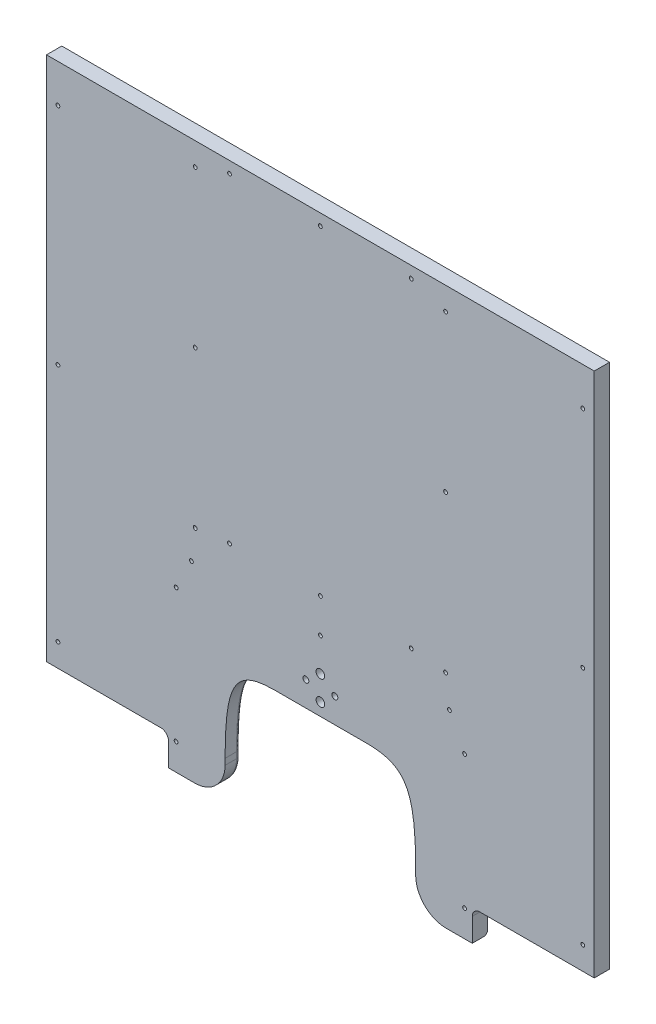
from build123d import *

# Parameters (mm, degrees)
BOSS_EXTRUDE1_DEPTH     = 12.7
FILLET2_SIZE            = 41.275
FILLET2_SIZE_2          = 69.85
FILLET3_R               = 25.4
FILLET4_R               = 19.05
FILLET5_START           = -1
FILLET5_DEPTH           = 15
FILLET6_R               = 127
CUT_EXTRUDE1_REACH      = 634.314
SKETCH3_W               = 241.600142069
SKETCH3_H               = 584.2
F_8_CLEARANCE_HOLE1_D   = 4.9149
F_1_4_CLEARANCE_HOLE1_D = 7.14248
HOLE1_D                 = 3.175
HOLE1_DEPTH             = 38.1
HOLE1_CSINK_D           = 10.16
HOLE1_CSINK_ANGLE       = 82
HOLE1_TIP               = 0.953866233
SKETCH10_W              = 115.111375733
SKETCH10_H              = 146.421249533
CUT_EXTRUDE2_DEPTH      = 25.4
FILLET8_R               = 6.35
FILLET8_OF_MIRROR6_R    = 6.35
FILLET7_R               = 3.175


with BuildPart() as part:
    # Sketch1 → Boss-Extrude1 (new body)
    with BuildSketch(Plane.XY):
        Polygon((-228.088766336, 0), (228.088766336, 0), (228.088766336, -443.878997916), (241.600142069, -584.2), (237.284597128, -584.2), (202.688766336, -463.55), (79.375, -463.55), (79.375, -363.22), (-79.375, -363.22), (-79.375, -463.55), (-202.688766336, -463.55), (-237.284597128, -584.2), (-241.600142069, -584.2), (-228.088766336, -443.878997916), align=None)
    extrude(amount=BOSS_EXTRUDE1_DEPTH)

    # Fillet2
    # a fillet whose section is not a circle: 69.85, 41.275 mm, written as the material it adds along each edge
    with BuildSketch(Plane(origin=(-79.375, -363.22, 0), x_dir=(1, 0, 0), z_dir=(0, 0, 1))) as fillet2_piece_1:
        with BuildLine():
            Bezier((FILLET2_SIZE, 0), (0, 0), (0, -FILLET2_SIZE_2), weights=[1, 1.5, 1])
            Line((0, -FILLET2_SIZE_2), (0, 0))
            Line((0, 0), (FILLET2_SIZE, 0))
        make_face()
    extrude(amount=12.7)

    # Fillet3
    fillet3_edges = [part.edges().sort_by_distance(p)[0] for p in [
        (-79.375, -463.55, 6.35),
    ]]
    fillet(fillet3_edges, radius=FILLET3_R)

    # Fillet4
    fillet4_edges = [part.edges().sort_by_distance(p)[0] for p in [
        (-202.688766336, -463.55, 6.35),
    ]]
    fillet(fillet4_edges, radius=FILLET4_R)

    # Fillet5: read off the stored shape, not the designer's step
    # Fillet5 outline → Fillet5 (cut)
    with BuildSketch(Plane.XY.offset(FILLET5_START)):
        with BuildLine():
            Line((-237.284597128, -584.2), (-224.526592015, -539.707548693))
            add(Edge.make_bspline(
                [(-224.526592015, -539.707548693), (-237.177095318, -583.825096633), (-241.600142069, -584.2)],
                knots=[0, 0, 0, 1, 1, 1], degree=2, weights=[1, 2.333333333, 1]))
            Line((-241.600142069, -584.2), (-237.284597128, -584.2))
        make_face()
    extrude(amount=FILLET5_DEPTH, mode=Mode.SUBTRACT)

    # Fillet6
    # the kernel refuses this fillet: 127 mm, written as the material it adds along each edge
    with BuildSketch(Plane(origin=(-228.088766336, -443.878997916, 0), x_dir=(0, 1, 0), z_dir=(0, 0, 1))) as fillet6_piece_1:
        with BuildLine():
            CenterArc((FILLET6_R * 0.0480334444852, FILLET6_R), FILLET6_R, 264.5, 5.5)
            Line((-FILLET6_R * 0.047812308035, FILLET6_R * 0.00460380163282), (0, 0))
            Line((0, 0), (FILLET6_R * 0.0480334444852, 0))
        make_face()
    extrude(amount=12.7)

    # Sketch3 → Cut-Extrude1 (cut, up to next)
    with BuildSketch(Plane.XY.offset(12.7), mode=Mode.PRIVATE) as cut_extrude1_sk1:
        with Locations((120.800071035, -292.1)):
            Rectangle(SKETCH3_W, SKETCH3_H)
    cut_extrude1_tool1 = extrude(cut_extrude1_sk1.sketch, amount=-CUT_EXTRUDE1_REACH, mode=Mode.PRIVATE) & part.part
    add(cut_extrude1_tool1.solids().sort_by_distance((120.800071, -292.1, 12.7))[0], mode=Mode.SUBTRACT)

    # Mirror5: part across plane


with BuildPart() as part_1:
    add(part.part)
    add(part.part.mirror(Plane(origin=(0, 0, -0.35025), x_dir=(0, 0, 1), z_dir=(-1, 0, 0))))

    # #8 Clearance Hole1 (through all)
    with Locations(Plane(origin=(0, 0, 0), x_dir=(-1, 0, 0), z_dir=(0, 0, -1))):
        with Locations((12.077216058, -342.5825), (-12.077216058, -342.5825)):
            Hole(F_8_CLEARANCE_HOLE1_D / 2)

    # 1/4 Clearance Hole1 (through all)
    with Locations(Plane(origin=(0, 0, 0), x_dir=(-1, 0, 0), z_dir=(0, 0, -1))):
        with Locations((0, -352.7425), (0, -332.4225)):
            Hole(F_1_4_CLEARANCE_HOLE1_D / 2)

    # Hole1
    with Locations(Plane(origin=(0, 0, 0), x_dir=(-1, 0, 0), z_dir=(0, 0, -1))):
        with Locations((-75.688766336, -9.525), (218.563766336, -31.75), (218.563766336, -218.821), (218.563766336, -418.592), (104.263766336, -19.05), (104.263766336, -149.225), (104.263766336, -279.4), (120.138766336, -330.2), (120.138766336, -441.325), (-120.138766336, -441.325), (-120.138766336, -330.2), (-104.263766336, -279.4), (-104.263766336, -149.225), (-104.263766336, -19.05), (-218.563766336, -418.592), (-218.563766336, -218.821), (-218.563766336, -31.75), (0, -304.8), (107.438766336, -304.8), (-107.438766336, -304.8), (75.688766336, -276.225), (0, -276.225), (-75.688766336, -276.225), (75.688766336, -9.525), (0, -9.525)):
            CounterSinkHole(HOLE1_D / 2, HOLE1_CSINK_D / 2, depth=HOLE1_DEPTH, counter_sink_angle=HOLE1_CSINK_ANGLE)
            with Locations((0, 0, -(HOLE1_DEPTH + HOLE1_TIP / 2))):  # 118° drill point
                Cone(0, HOLE1_D / 2, HOLE1_TIP, mode=Mode.SUBTRACT)

    # Sketch10 → Cut-Extrude2 (cut)
    with BuildSketch(Plane(origin=(0, 0, 0), x_dir=(-1, 0, 0), z_dir=(0, 0, -1))):
        with Locations((184.044454203, -510.989375234)):
            Rectangle(SKETCH10_W, SKETCH10_H)
    cut_extrude2 = extrude(amount=-CUT_EXTRUDE2_DEPTH, mode=Mode.SUBTRACT)

    # Fillet8
    fillet8_edges = [part_1.edges().sort_by_distance(p)[0] for p in [
        (-126.488766336, -437.778750467, 6.35),
    ]]
    fillet(fillet8_edges, radius=FILLET8_R)

    # Mirror6: Cut-Extrude2 across plane
    add(cut_extrude2.mirror(Plane(origin=(0, 0, 0), x_dir=(0, 0, 1), z_dir=(1, 0, 0))), mode=Mode.SUBTRACT)

    # Fillet8 of Mirror6
    fillet8_of_mirror6_edges = [part_1.edges().sort_by_distance(p)[0] for p in [
        (126.488766336, -437.778750467, 6.35),
    ]]
    fillet(fillet8_of_mirror6_edges, radius=FILLET8_OF_MIRROR6_R)

    # Fillet7
    fillet7_edges = [part_1.edges().sort_by_distance(p)[0] for p in [
        (115.631883168, -463.55, 0),
        (86.814487758, -456.110512242, 0),
        (79.375, -435.61, 0),
        (74.895581782, -386.035681558, 0),
        (0, -363.22, 0),
        (-74.895581782, -386.035681558, 0),
        (-79.375, -435.61, 0),
        (-86.814487758, -456.110512242, 0),
        (-115.631883168, -463.55, 0),
    ]]
    fillet(fillet7_edges, radius=FILLET7_R)


solid = part_1.part
